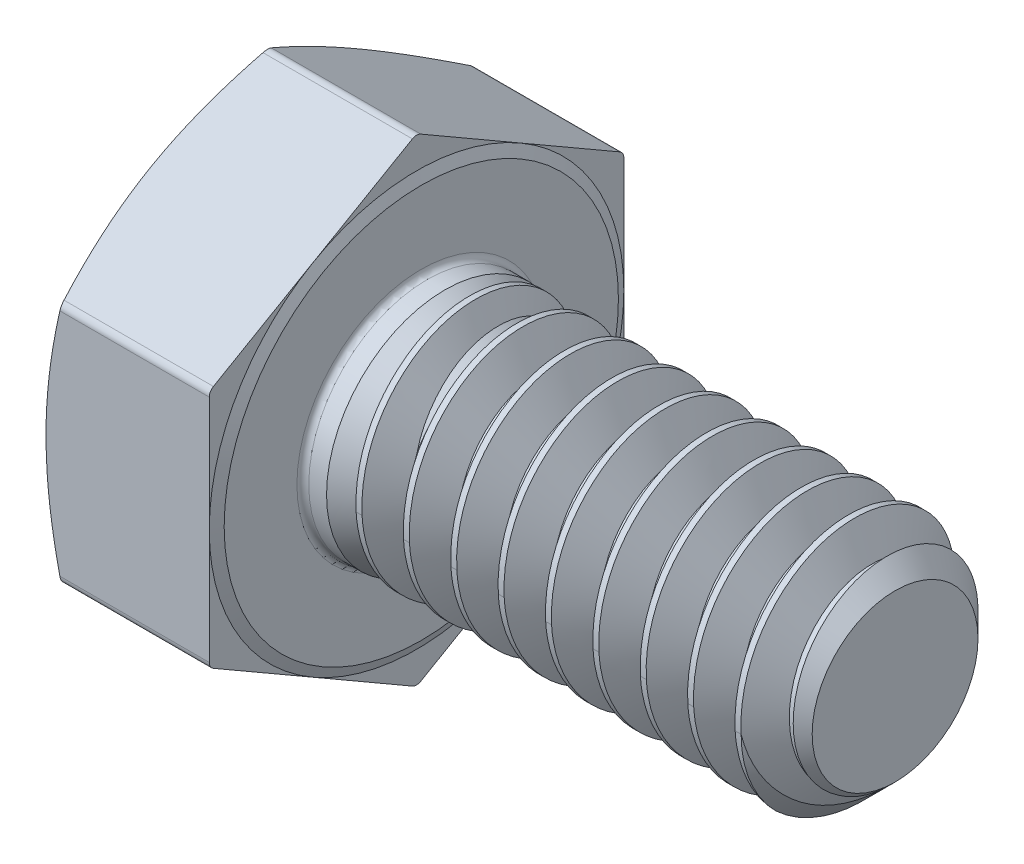
from build123d import *

# Parameters (mm, degrees)
SKETCH2_R                = 3.175
BOSS_EXTRUDE1_DEPTH      = 12.7
BOSS_EXTRUDE2_DEPTH      = 4.7625
SKETCH5_OUTSIDE_W        = 38.41
SKETCH5_OUTSIDE_H        = 40.13
SKETCH5_OUTSIDE_R        = 5.000625
CUT_EXTRUDE1_DEPTH       = 4.7625
CUT_EXTRUDE1_DRAFT       = -65
BOSS_EXTRUDE5_DEPTH      = 0.0635
FILLET5_R                = 0.0635
FILLET6_R                = 0.0635
CIRPATTERN1_COUNT        = 9
FILLET5_OF_CIRPATTERN1_R = 0.0635
FILLET6_OF_CIRPATTERN1_R = 0.0635
SKETCH16_R               = 2.5003125
CUT_EXTRUDE2_DEPTH       = 0.508
CUT_EXTRUDE2_DRAFT       = -60
FILLET7_R                = 0.22225
CHAMFER1_SIZE            = 0.9525
FILLET4_R                = 0.15875
CUT_SWEEP1_PITCH         = 1.27
CUT_SWEEP1_TO            = 12.065


with BuildPart() as part:
    # Sketch2 → Boss-Extrude1 (new body)
    with BuildSketch(Plane(origin=(0, 0, 0), x_dir=(0, 0, -1), z_dir=(1, 0, 0))):
        Circle(SKETCH2_R)
    extrude(amount=BOSS_EXTRUDE1_DEPTH)

    # Sketch3 → Boss-Extrude2 (add)
    with BuildSketch(Plane.ZY):
        Polygon((0, 6.415804866), (-5.55625, 3.207902433), (-5.55625, -3.207902433), (0, -6.415804866), (5.55625, -3.207902433), (5.55625, 3.207902433), align=None)
    extrude(amount=BOSS_EXTRUDE2_DEPTH)


with BuildPart() as cut_extrude1_tool:
    # Sketch5 outside → Cut-Extrude1 (with draft: the straight prism first)
    with BuildSketch(Plane.ZY.offset(4.7625)):
        Rectangle(SKETCH5_OUTSIDE_W, SKETCH5_OUTSIDE_H)
        Circle(SKETCH5_OUTSIDE_R, mode=Mode.SUBTRACT)
    extrude(amount=-CUT_EXTRUDE1_DEPTH)
    # Cut-Extrude1: the draft: its side faces are tilted about the plane it starts from
    cut_extrude1_sides = [cut_extrude1_tool.faces().sort_by_distance(p)[0] for p in [
        (-2.38125, -20.065, 0),
        (-2.38125, 0, 19.205),
        (-2.38125, 20.065, 0),
        (-2.38125, 0, -19.205),
        (-2.38125, 0, -5.000625),
    ]]
    draft(cut_extrude1_sides, Plane.ZY.offset(4.7625), CUT_EXTRUDE1_DRAFT)


with BuildPart() as part_1:
    add(part.part)

    # Cut-Extrude1: cut by cut_extrude1_tool
    add(cut_extrude1_tool.part, mode=Mode.SUBTRACT)

    # Sketch11 → Boss-Extrude5 (add)
    with BuildSketch(Plane.ZY.offset(4.7625)):
        with BuildLine():
            Line((0.19446875, 4.66725), (0.19446875, 2.97259375))
            ThreePointArc((0.19446875, 2.97259375), (0, 2.778125), (-0.19446875, 2.97259375))
            Line((-0.19446875, 2.97259375), (-0.19446875, 4.66725))
            ThreePointArc((-0.19446875, 4.66725), (0, 4.86171875), (0.19446875, 4.66725))
        make_face()
    boss_extrude5 = extrude(amount=BOSS_EXTRUDE5_DEPTH)

    # Fillet5
    fillet5_edges = [part_1.edges().sort_by_distance(p)[0] for p in [
        (-4.826, 3.819921875, 0.19446875),
        (-4.826, 2.778125, 0),
        (-4.826, 3.819921875, -0.19446875),
        (-4.826, 4.86171875, 0),
    ]]
    fillet(fillet5_edges, radius=FILLET5_R - 0.0001)  # a hair under: the kernel refuses the full size

    # Fillet6
    fillet6_edges = [part_1.edges().sort_by_distance(p)[0] for p in [
        (-4.7625, 4.86171875, 0),
        (-4.7625, 3.819921875, -0.19446875),
        (-4.7625, 2.778125, 0),
        (-4.7625, 3.819921875, 0.19446875),
    ]]
    fillet(fillet6_edges, radius=FILLET6_R)

    # CirPattern1: Boss-Extrude5 ×9 about axis
    cirpattern1_axis = Axis((0, 0, 0), (1, 0, 0))
    for i in range(1, CIRPATTERN1_COUNT):
        add(boss_extrude5.rotate(cirpattern1_axis, i * 360 / CIRPATTERN1_COUNT))

    # Fillet5 of CirPattern1
    fillet5_of_cirpattern1_edges = [part_1.edges().sort_by_distance(p)[0] for p in [
        (-4.826, 2.801227823, 2.604370157),
        (-4.826, 2.128167219, 1.785744328),
        (-4.826, 3.051232028, 2.306426746),
        (-4.826, 3.724292632, 3.125052574),
        (-4.826, 0.47180814, 3.795657822),
        (-4.826, 0.482416344, 2.735919039),
        (-4.826, 0.854836805, 3.728119534),
        (-4.826, 0.844228601, 4.787858318),
        (-4.826, -2.078375815, 3.210915009),
        (-4.826, -1.3890625, 2.405926825),
        (-4.826, -1.74154606, 3.405383759),
        (-4.826, -2.430859375, 4.210371944),
        (-4.826, -3.656064628, 1.123749378),
        (-4.826, -2.610583562, 0.950174711),
        (-4.826, -3.523040168, 1.489231077),
        (-4.826, -4.568521234, 1.662805744),
        (-4.826, -3.523040168, -1.489231077),
        (-4.826, -2.610583562, -0.950174711),
        (-4.826, -3.656064628, -1.123749378),
        (-4.826, -4.568521234, -1.662805744),
        (-4.826, -1.74154606, -3.405383759),
        (-4.826, -1.3890625, -2.405926825),
        (-4.826, -2.078375815, -3.210915009),
        (-4.826, -2.430859375, -4.210371944),
        (-4.826, 0.854836805, -3.728119534),
        (-4.826, 0.482416344, -2.735919039),
        (-4.826, 0.47180814, -3.795657822),
        (-4.826, 0.844228601, -4.787858318),
        (-4.826, 3.051232028, -2.306426746),
        (-4.826, 2.128167219, -1.785744328),
        (-4.826, 2.801227823, -2.604370157),
        (-4.826, 3.724292632, -3.125052574),
    ]]
    fillet(fillet5_of_cirpattern1_edges, radius=FILLET5_OF_CIRPATTERN1_R - 0.0001)  # a hair under: the kernel refuses the full size

    # Fillet6 of CirPattern1
    fillet6_of_cirpattern1_edges = [part_1.edges().sort_by_distance(p)[0] for p in [
        (-4.7625, 3.724292632, 3.125052574),
        (-4.7625, 3.051232028, 2.306426746),
        (-4.7625, 2.128167219, 1.785744328),
        (-4.7625, 2.801227823, 2.604370157),
        (-4.7625, 0.844228601, 4.787858318),
        (-4.7625, 0.854836805, 3.728119534),
        (-4.7625, 0.482416344, 2.735919039),
        (-4.7625, 0.47180814, 3.795657822),
        (-4.7625, -2.430859375, 4.210371944),
        (-4.7625, -1.74154606, 3.405383759),
        (-4.7625, -1.3890625, 2.405926825),
        (-4.7625, -2.078375815, 3.210915009),
        (-4.7625, -4.568521234, 1.662805744),
        (-4.7625, -3.523040168, 1.489231077),
        (-4.7625, -2.610583562, 0.950174711),
        (-4.7625, -3.656064628, 1.123749378),
        (-4.7625, -4.568521234, -1.662805744),
        (-4.7625, -3.656064628, -1.123749378),
        (-4.7625, -2.610583562, -0.950174711),
        (-4.7625, -3.523040168, -1.489231077),
        (-4.7625, -2.430859375, -4.210371944),
        (-4.7625, -2.078375815, -3.210915009),
        (-4.7625, -1.3890625, -2.405926825),
        (-4.7625, -1.74154606, -3.405383759),
        (-4.7625, 0.844228601, -4.787858318),
        (-4.7625, 0.47180814, -3.795657822),
        (-4.7625, 0.482416344, -2.735919039),
        (-4.7625, 0.854836805, -3.728119534),
        (-4.7625, 3.724292632, -3.125052574),
        (-4.7625, 2.801227823, -2.604370157),
        (-4.7625, 2.128167219, -1.785744328),
        (-4.7625, 3.051232028, -2.306426746),
    ]]
    fillet(fillet6_of_cirpattern1_edges, radius=FILLET6_OF_CIRPATTERN1_R)


with BuildPart() as cut_extrude2_tool:
    # Sketch16 → Cut-Extrude2 (with draft: the straight prism first)
    with BuildSketch(Plane.ZY.offset(4.7625)):
        Circle(SKETCH16_R)
    extrude(amount=-CUT_EXTRUDE2_DEPTH)
    # Cut-Extrude2: the draft: its side faces are tilted about the plane it starts from
    cut_extrude2_sides = [cut_extrude2_tool.faces().sort_by_distance(p)[0] for p in [
        (-4.5085, 0, -2.5003125),
    ]]
    draft(cut_extrude2_sides, Plane.ZY.offset(4.7625), CUT_EXTRUDE2_DRAFT)


with BuildPart() as part_2:
    add(part_1.part)

    # Cut-Extrude2: cut by cut_extrude2_tool
    add(cut_extrude2_tool.part, mode=Mode.SUBTRACT)

    # Fillet7
    fillet7_edges = [part_2.edges().sort_by_distance(p)[0] for p in [
        (-2.051295395, -6.415804866, 0),
        (-2.051295395, -3.207902433, -5.55625),
        (-2.051295395, 3.207902433, -5.55625),
        (-2.051295395, 6.415804866, 0),
        (-2.051295395, -3.207902433, 5.55625),
        (-2.051295395, 3.207902433, 5.55625),
    ]]
    fillet(fillet7_edges, radius=FILLET7_R)

    # Chamfer1
    chamfer1_edges = [part_2.edges().sort_by_distance(p)[0] for p in [
        (12.7, 0, 3.175),
    ]]
    chamfer(chamfer1_edges, length=CHAMFER1_SIZE)

    # Sketch15 → Cut-Revolve1 (revolve, cut)
    with BuildSketch(Plane.XY, mode=Mode.PRIVATE) as cut_revolve1_sk:
        Polygon((0, 5.283897621), (-0.127, 5.55625), (-0.127, 6.415804866), (0, 6.415804866), align=None)
    revolve(cut_revolve1_sk.sketch.rotate(Axis((0, 0, 0), (-1, 0, 0)), 210), axis=Axis((0, 0, 0), (-1, 0, 0)), mode=Mode.SUBTRACT)

    # Fillet4
    fillet4_edges = [part_2.edges().sort_by_distance(p)[0] for p in [
        (0, 0, 3.175),
    ]]
    fillet(fillet4_edges, radius=FILLET4_R)


with BuildPart() as body_2:
    # Split1: the piece on the far side of the plane
    add(part_2.part)
    split(bisect_by=Plane(origin=(0.635, 0, 0), x_dir=(0, 0, 1), z_dir=(1, 0, 0)), keep=Keep.BOTTOM)


with BuildPart() as part_3:
    add(part_2.part)

    # Split1
    split(bisect_by=Plane(origin=(0.635, 0, 0), x_dir=(0, 0, 1), z_dir=(1, 0, 0)), keep=Keep.TOP)

    # Cut-Sweep1: arcs per turn and ends read off the stored shape
    # Cut-Sweep1: the profile of Sketch13 profile screwed along a right-hand helix through 11 turns, 8 arcs to a turn; built about Z, then put on its axis
    cut_sweep1_z = Axis((0, 0, 0), (0, 0, 1))
    cut_sweep1_corners = [(3.1753, 0, 0.000173205), (3.1753, 0, -1.111423205), (2.350110803, 0, -0.635), (2.350110803, 0, -0.47625)]
    with BuildLine(mode=Mode.PRIVATE) as cut_sweep1_profile:
        Line(cut_sweep1_corners[0], cut_sweep1_corners[1])
        Line(cut_sweep1_corners[1], cut_sweep1_corners[2])
        Line(cut_sweep1_corners[2], cut_sweep1_corners[3])
        Line(cut_sweep1_corners[3], cut_sweep1_corners[0])
    cut_sweep1_cap = Face(cut_sweep1_profile.wire())
    cut_sweep1_turn_angles = [0, 22.5, 45, 67.5, 90, 112.5, 135, 157.5, 180, 202.5, 225, 247.5, 270, 292.5, 315, 337.5, 360]
    cut_sweep1_turn_weights = [1, 0.9238795325112867, 1, 0.9238795325112867, 1, 0.9238795325112867, 1, 0.9238795325112867, 1, 0.9238795325112867, 1, 0.9238795325112867, 1, 0.9238795325112867, 1, 0.9238795325112867, 1]
    cut_sweep1_turn_rails = [Edge.make_bspline([Vector(p[0], p[1], 0).rotate(cut_sweep1_z, cut_sweep1_turn_angles[k]) / cut_sweep1_turn_weights[k] + Vector(0, 0, p[2] + CUT_SWEEP1_PITCH * cut_sweep1_turn_angles[k] / 360) for k in range(17)], [0, 0, 0, 1, 1, 2, 2, 3, 3, 4, 4, 5, 5, 6, 6, 7, 7, 8, 8, 8], 2, cut_sweep1_turn_weights) for p in cut_sweep1_corners]
    cut_sweep1_turn_sides = [Face.make_surface_from_curves(cut_sweep1_turn_rails[p[0]], cut_sweep1_turn_rails[p[1]]) for p in [(0, 1), (1, 2), (2, 3), (3, 0)]]
    cut_sweep1 = Plane(origin=(12.7, 0, 0), x_dir=(0, 1, 0), z_dir=(-1, 0, 0)) * split(Solid(Shell([*[p.moved(Location((0, 0, CUT_SWEEP1_PITCH * i))) for i in range(11) for p in cut_sweep1_turn_sides], cut_sweep1_cap, cut_sweep1_cap.rotate(cut_sweep1_z, 3960).moved(Location((0, 0, CUT_SWEEP1_PITCH * 3960 / 360)))])), bisect_by=Plane.XY.offset(CUT_SWEEP1_TO), keep=Keep.BOTTOM, mode=Mode.PRIVATE)
    add(cut_sweep1, mode=Mode.SUBTRACT)

    add(body_2.part)  # Boss-Extrude4 merges body 2
    # Boss-Extrude4: read off the stored shape, not the designer's step
    # Boss-Extrude4 outline → Boss-Extrude4 (revolve)
    with BuildSketch(Plane.YX):
        Polygon((3.175, 0.635), (2.350107303, 1.965415723), (2.350107303, 0.635), align=None)
    revolve(axis=Axis((0, 0, 0), (1, 0, 0)))


solid = part_3.part
